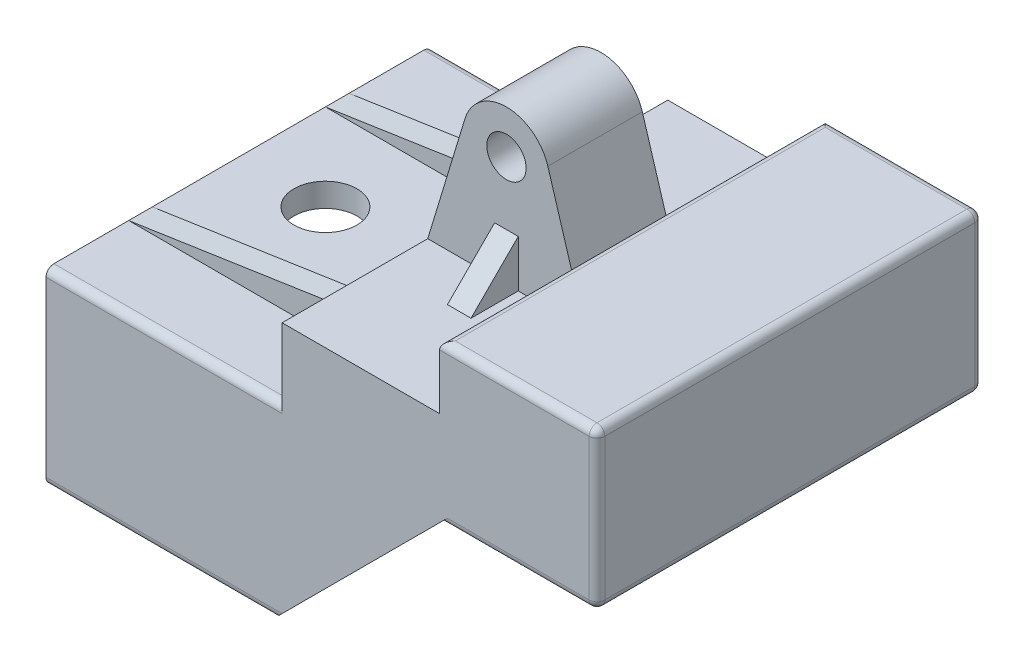
from build123d import *

# Parameters (mm, degrees)
EXTRUDE_1_DEPTH         = 30
EXTRUDE_1_DEPTH_BACK    = 40
SKETCH_2_W              = 49
SKETCH_2_H              = 24
SKETCH_2_W_2            = 43
SKETCH_2_H_2            = 18
SKETCH_1_R              = 2.5
EXTRUDE_1_2_DEPTH       = 6
SKETCH_1_3_W            = 20
SKETCH_1_3_H            = 8
EXTRUDE_2_DEPTH         = 24.5
CUT_EXTRUDE_1_DEPTH     = 25
RIB_1_REACH             = 58.032
SKETCH_4_WALLS_W        = 145.49538697
SKETCH_4_WALLS_H        = 3
RIB_2_REACH             = 65.649
SKETCH_6_WALLS_W        = 3
SKETCH_6_WALLS_H        = 137.784142328
CUT_EXTRUDE_START       = -12
CUT_EXTRUDE_2_OUTLINE_R = 4
CUT_EXTRUDE_2_DEPTH     = 3
FILLET_1_R              = 1


# Read off the part's stored shape, not the designer's step: 컷-돌출2
with BuildPart() as part:
    # 스케치2 → Extrude 1 (new, two sides: drawn at the far end of the back side and taken through both)
    with BuildSketch(Plane(origin=(0, 0, 0), x_dir=(0, 0, -1), z_dir=(1, 0, 0)).offset(-EXTRUDE_1_DEPTH_BACK)):
        with Locations((0, -21)):
            Rectangle(SKETCH_2_W, SKETCH_2_H)
        with Locations((0, -21)):
            Rectangle(SKETCH_2_W_2, SKETCH_2_H_2, mode=Mode.SUBTRACT)
    extrude(amount=EXTRUDE_1_DEPTH + EXTRUDE_1_DEPTH_BACK)



with BuildPart() as body_2:
    # 스케치1 → Extrude 1 2 (new, symmetric)
    with BuildSketch(Plane.XY):
        with BuildLine():
            ThreePointArc((-5.262640911, 15.598314937), (0, 19.5), (5.262640911, 15.598314937))
            Line((5.262640911, 15.598314937), (10, 0))
            Line((10, 0), (-10, 0))
            Line((-10, 0), (-5.262640911, 15.598314937))
        make_face()
        with Locations((0, 14)):
            Circle(SKETCH_1_R, mode=Mode.SUBTRACT)
    extrude(amount=EXTRUDE_1_2_DEPTH, both=True)


with BuildPart() as part_1:
    add(part.part)

    add(body_2.part)  # 보스-돌출2 merges body 2
    # 스케치1<3> → 보스-돌출2 (add, symmetric)
    with BuildSketch(Plane.XY):
        Polygon((10, 0), (-10, 0), (-10, -12), (10, -12), (30, -12), (30, 0), align=None)
        with Locations((20, 4)):
            Rectangle(SKETCH_1_3_W, SKETCH_1_3_H)
    extrude(amount=EXTRUDE_2_DEPTH, both=True)

    # 스케치1<4> → 컷-돌출1 (cut, symmetric)
    with BuildSketch(Plane.XY):
        Polygon((30, -12), (10, -12), (-11, -33), (30, -33), align=None)
    extrude(amount=CUT_EXTRUDE_1_DEPTH, both=True, mode=Mode.SUBTRACT)

    # 스케치4 walls → 보강대1 (add, up to next)
    with BuildSketch(Plane(origin=(0.4400978, -2.93398533, 0), x_dir=(0.9889363528682976, 0.14834045293024456, 0), z_dir=(-0.14834045293024456, 0.9889363528682976, 0)), mode=Mode.PRIVATE) as rib_1_sk1:
        with Locations((-25.177107795, -12.5)):
            Rectangle(SKETCH_4_WALLS_W, SKETCH_4_WALLS_H)
    rib_1_tool1 = extrude(rib_1_sk1.sketch, amount=-RIB_1_REACH, mode=Mode.PRIVATE) - part_1.part
    # 스케치4 walls → 보강대1 (add, up to next)
    with BuildSketch(Plane(origin=(0.4400978, -2.93398533, 0), x_dir=(0.9889363528682976, 0.14834045293024456, 0), z_dir=(-0.14834045293024456, 0.9889363528682976, 0)), mode=Mode.PRIVATE) as rib_1_sk2:
        with Locations((-25.177107795, 12.5)):
            Rectangle(SKETCH_4_WALLS_W, SKETCH_4_WALLS_H)
    rib_1_tool2 = extrude(rib_1_sk2.sketch, amount=-RIB_1_REACH, mode=Mode.PRIVATE) - part_1.part
    add(rib_1_tool1.solids().sort_by_distance((-24.458459359, -6.668768904, 12.5))[0])
    add(rib_1_tool2.solids().sort_by_distance((-24.458459359, -6.668768904, -12.5))[0])

    # 스케치6 walls → 보강대2 (add, up to next)
    with BuildSketch(Plane(origin=(0, 6, -6), x_dir=(1, 0, 0), z_dir=(0, 0.7071067811865477, -0.7071067811865474)), mode=Mode.PRIVATE) as rib_2_sk1:
        with Locations((0, 4.242640687)):
            Rectangle(SKETCH_6_WALLS_W, SKETCH_6_WALLS_H)
    rib_2_tool1 = extrude(rib_2_sk1.sketch, amount=-RIB_2_REACH, mode=Mode.PRIVATE) - part_1.part
    rib_2 = rib_2_tool1.solids().sort_by_distance((0, 3, -9))[0]
    add(rib_2)

    # 대칭 복사1: 보강대2 across plane
    add(rib_2.mirror(Plane.XY))

    # 컷-돌출2 outline → 컷-돌출2 (cut)
    with BuildSketch(Plane(origin=(0, 0, 0), x_dir=(1, 0, 0), z_dir=(0, 1, 0)).offset(CUT_EXTRUDE_START)):
        with Locations((-29, 0)):
            Circle(CUT_EXTRUDE_2_OUTLINE_R)
    extrude(amount=CUT_EXTRUDE_2_DEPTH, mode=Mode.SUBTRACT)

    # 필렛1
    fillet_1_edges = [part_1.edges().sort_by_distance(p)[0] for p in [
        (30, -2, 24.5),
        (30, -12, 0),
        (20, 8, -24.5),
        (30, 8, 0),
        (10, 8, 0),
        (20, 8, 24.5),
        (-25.5, -33, 24.5),
        (-25, -9, 24.5),
        (-25, -9, -24.5),
        (-25.5, -33, -24.5),
        (30, -2, -24.5),
        (20, -12, 24.5),
        (20, -12, -24.5),
    ]]
    fillet(fillet_1_edges, radius=FILLET_1_R)


solid = part_1.part
